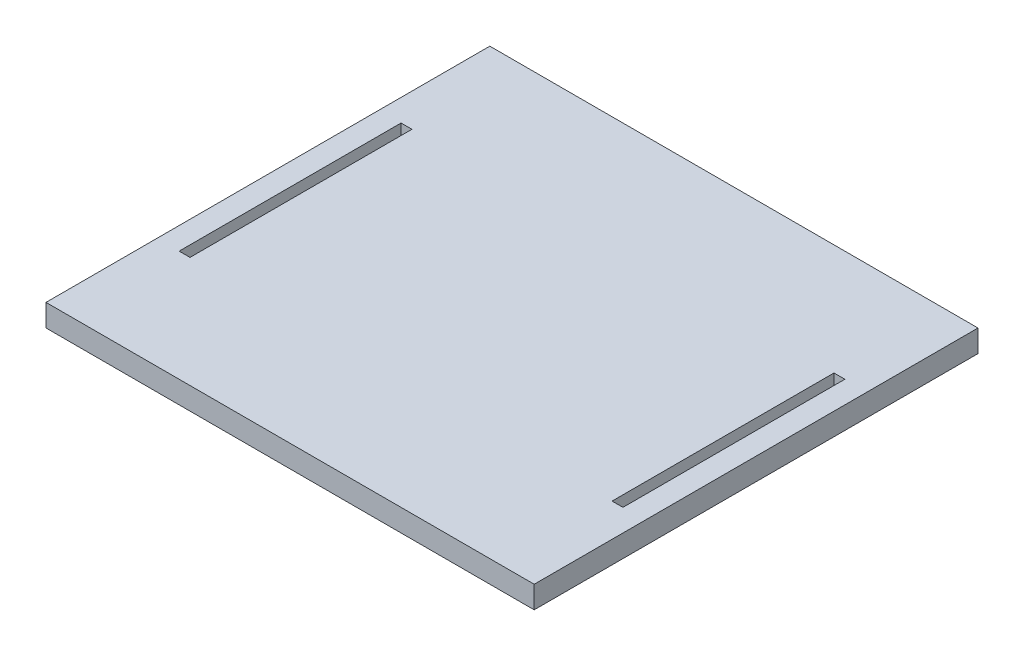
from build123d import *

# Parameters (mm, degrees)
CROQUIS1_W              = 220
CROQUIS1_H              = 200
CROQUIS1_W_2            = 4.9
CROQUIS1_H_2            = 100
SALIENTE_EXTRUIR1_DEPTH = 10


with BuildPart() as part:
    # Croquis1 → Saliente-Extruir1 (new body)
    with BuildSketch(Plane(origin=(0, 0, 0), x_dir=(1, 0, 0), z_dir=(0, 1, 0))):
        Rectangle(CROQUIS1_W, CROQUIS1_H)
        with Locations((-97.55, 0)):
            Rectangle(CROQUIS1_W_2, CROQUIS1_H_2, mode=Mode.SUBTRACT)
        with Locations((97.55, 0)):
            Rectangle(CROQUIS1_W_2, CROQUIS1_H_2, mode=Mode.SUBTRACT)
    extrude(amount=SALIENTE_EXTRUIR1_DEPTH)


solid = part.part
